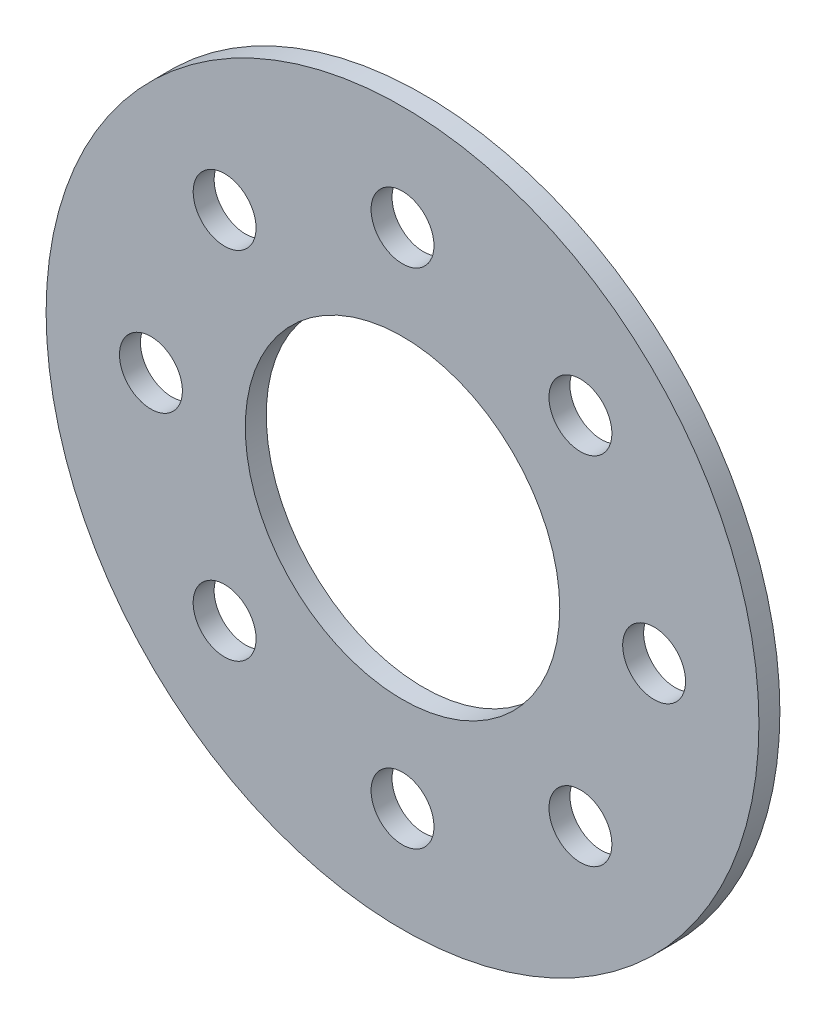
from build123d import *

# Parameters (mm, degrees)
SKETCH1_R           = 17
SKETCH1_R_2         = 7.5
BOSS_EXTRUDE1_DEPTH = 1
SKETCH2_R           = 1.5
CUT_EXTRUDE1_DEPTH  = 25.062418831
CIRPATTERN1_COUNT   = 8


with BuildPart() as part:
    # Sketch1 → Boss-Extrude1 (new body)
    with BuildSketch(Plane.XY):
        Circle(SKETCH1_R)
        Circle(SKETCH1_R_2, mode=Mode.SUBTRACT)
    extrude(amount=BOSS_EXTRUDE1_DEPTH)

    # Sketch2 → Cut-Extrude1 (cut, symmetric)
    with BuildSketch(Plane.XY.offset(1)):
        with Locations((0, 12)):
            Circle(SKETCH2_R)
    cut_extrude1 = extrude(amount=CUT_EXTRUDE1_DEPTH, both=True, mode=Mode.SUBTRACT)

    # CirPattern1: Cut-Extrude1 ×8 about axis
    cirpattern1_axis = Axis((0, 0, 1), (0, 0, -1))
    for i in range(1, CIRPATTERN1_COUNT):
        add(cut_extrude1.rotate(cirpattern1_axis, i * 360 / CIRPATTERN1_COUNT), mode=Mode.SUBTRACT)


solid = part.part
